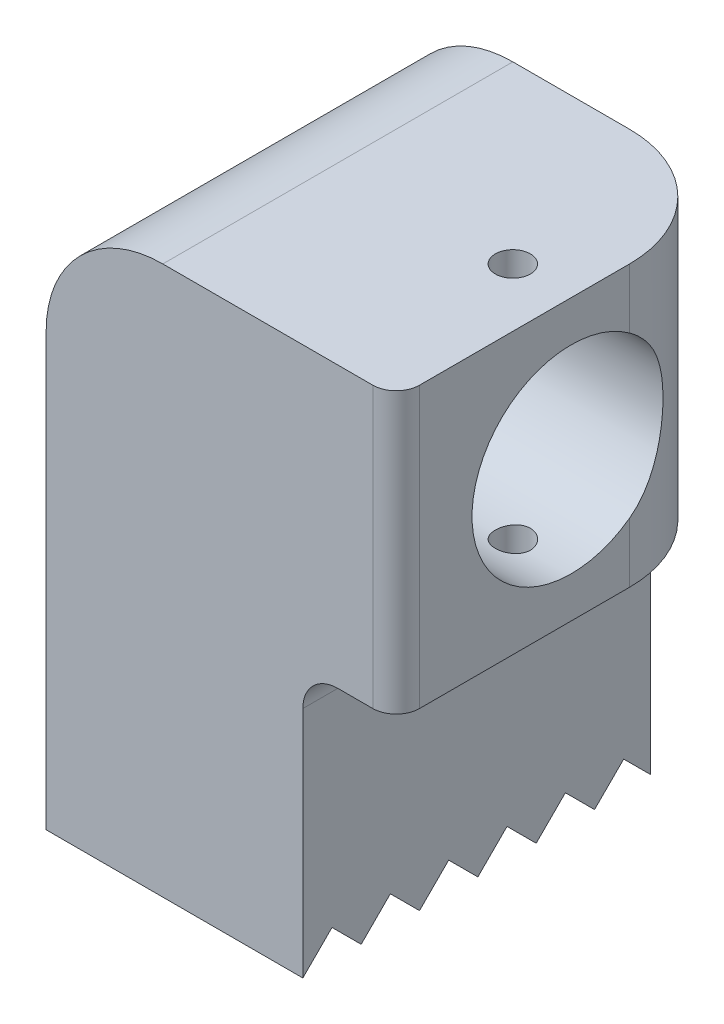
from build123d import *

# Parameters (mm, degrees)
CROQUIS1_W              = 30
CROQUIS1_H              = 24
CROQUIS1_W_2            = 22
CROQUIS1_H_2            = 23
SALIENTE_EXTRUIR1_DEPTH = 15
CROQUIS2_R              = 8.5
CORTAR_EXTRUIR1_DEPTH   = 25
REDONDEO1_R             = 10
REDONDEO2_R             = 10
CROQUIS5_R              = 1.5
CORTAR_EXTRUIR3_DEPTH   = 30
REDONDEO3_R             = 2
CORTAR_EXTRUIR4_DEPTH   = 25
CROQUIS7_R              = 1.25
CORTAR_EXTRUIR5_DEPTH   = 10
REDONDEO4_START         = 1.500000102
REDONDEO4_DEPTH         = 13.499999898
REDONDEO4_START_2       = -11.985627603
REDONDEO4_2_DEPTH       = 10.485627421
REDONDEO4_START_3       = -14.797959071
REDONDEO4_3_DEPTH       = 16.297959173
REDONDEO4_START_4       = -16
REDONDEO4_4_DEPTH       = 4


with BuildPart() as part:
    # Croquis1 → Saliente-Extruir1 (new, symmetric)
    with BuildSketch(Plane.XY):
        Rectangle(CROQUIS1_W, CROQUIS1_H)
        with Locations((-4, -23.5)):
            Rectangle(CROQUIS1_W_2, CROQUIS1_H_2)
    extrude(amount=SALIENTE_EXTRUIR1_DEPTH, both=True)

    # Croquis2 → Cortar-Extruir1 (cut)
    with BuildSketch(Plane(origin=(15, 0, 0), x_dir=(0, 0, -1), z_dir=(1, 0, 0))):
        Circle(CROQUIS2_R)
    extrude(amount=-CORTAR_EXTRUIR1_DEPTH, mode=Mode.SUBTRACT)

    # Redondeo1
    redondeo1_edges = [part.edges().sort_by_distance(p)[0] for p in [
        (-15, 12, 0),
    ]]
    fillet(redondeo1_edges, radius=REDONDEO1_R)

    # Redondeo2
    # the kernel refuses this fillet: 10 mm, written as the material it takes off along each edge
    with BuildSketch(Plane(origin=(15, -37, -15), x_dir=(0, 0, 1), z_dir=(0, 1, 0))) as redondeo2_piece_1:
        with BuildLine():
            CenterArc((REDONDEO2_R, -REDONDEO2_R), REDONDEO2_R, 90, 90)
            Line((0, -REDONDEO2_R), (0, 0))
            Line((0, 0), (REDONDEO2_R, 0))
        make_face()
    extrude(amount=74, mode=Mode.SUBTRACT)

    # Croquis5 → Cortar-Extruir3 (cut)
    with BuildSketch(Plane(origin=(0, 12, 0), x_dir=(1, 0, 0), z_dir=(0, 1, 0))):
        with Locations(Location((10, 0, 0), (0, 0, 270))):
            Circle(CROQUIS5_R)
    extrude(amount=-CORTAR_EXTRUIR3_DEPTH, mode=Mode.SUBTRACT)

    # Redondeo3
    redondeo3_edges = [part.edges().sort_by_distance(p)[0] for p in [
        (15, 0, 15),
    ]]
    fillet(redondeo3_edges, radius=REDONDEO3_R)

    # Croquis6 → Cortar-Extruir4 (cut)
    with BuildSketch(Plane.ZY.offset(15)):
        Polygon((12.5, -32.5), (10, -35), (15, -35), align=None)
        Polygon((7.5, -32.5), (5, -35), (10, -35), align=None)
        Polygon((2.5, -32.5), (0, -35), (5, -35), align=None)
        Polygon((-2.5, -32.5), (-5, -35), (0, -35), align=None)
        Polygon((-7.5, -32.5), (-10, -35), (-5, -35), align=None)
        Polygon((-12.5, -32.5), (-15, -35), (-10, -35), align=None)
    extrude(amount=-CORTAR_EXTRUIR4_DEPTH, mode=Mode.SUBTRACT)

    # Croquis7 → Cortar-Extruir5 (cut)
    with BuildSketch(Plane.ZY.offset(15)):
        with Locations((0, -14)):
            Circle(CROQUIS7_R)
        with Locations((0, -26)):
            Circle(CROQUIS7_R)
    extrude(amount=-CORTAR_EXTRUIR5_DEPTH, mode=Mode.SUBTRACT)

    # Redondeo4: read off the stored shape, not the designer's step
    # Redondeo4 outline → Redondeo4 (add)
    with BuildSketch(Plane.XY.offset(REDONDEO4_START)):
        with BuildLine():
            Line((7, -12), (7, -15))
            ThreePointArc((7, -15), (7.878679656, -12.878679656), (10, -12))
            Line((10, -12), (7, -12))
        make_face()
    extrude(amount=REDONDEO4_DEPTH)

    # Redondeo4 2 outline → Redondeo4 2 (add)
    with BuildSketch(Plane.XY.offset(REDONDEO4_START_2)):
        with BuildLine():
            Line((7, -12), (7, -15))
            ThreePointArc((7, -15), (7.878679656, -12.878679656), (10, -12))
            Line((10, -12), (7, -12))
        make_face()
    extrude(amount=REDONDEO4_2_DEPTH)

    # Redondeo4 3 outline → Redondeo4 3 (add)
    with BuildSketch(Plane.XY.offset(REDONDEO4_START_3)):
        with BuildLine():
            Line((7, -12), (7, -15))
            ThreePointArc((7, -15), (7.878679656, -12.878679656), (10, -12))
            Line((10, -12), (7, -12))
        make_face()
    extrude(amount=REDONDEO4_3_DEPTH)

    # Redondeo4 4 outline → Redondeo4 4 (cut)
    with BuildSketch(Plane(origin=(0, 0, 0), x_dir=(1, 0, 0), z_dir=(0, 1, 0)).offset(REDONDEO4_START_4)):
        with BuildLine():
            ThreePointArc((7, 14.797958971), (8.545926272, 14.350208921), (10, 13.660254038))
            Line((10, 13.660254038), (10, 14.797959071))
            Line((10, 14.797959071), (7, 14.797958971))
        make_face()
        with BuildLine():
            Line((10, -1.5), (10, 1.5))
            ThreePointArc((10, 1.5), (8.5, 0), (10, -1.5))
        make_face()
    extrude(amount=REDONDEO4_4_DEPTH, mode=Mode.SUBTRACT)


solid = part.part
